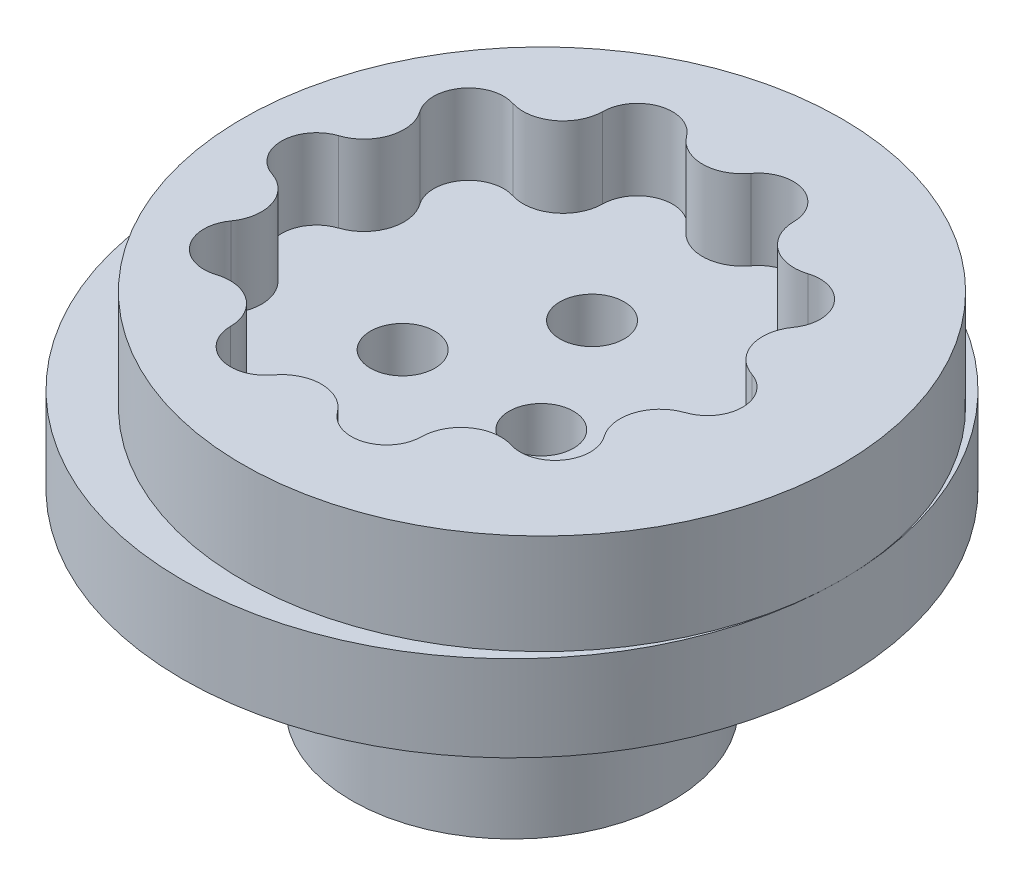
from build123d import *

# Parameters (mm, degrees)
SKETCH1_R               = 26.14295
BOSS_EXTRUDE1_DEPTH     = 8.397875
SKETCH2_R               = 12.7
BOSS_EXTRUDE2_DEPTH     = 15.08125
BOSS_EXTRUDE3_START     = 6.35
SKETCH3_R               = 26.14295
BOSS_EXTRUDE3_DEPTH     = 6.35
F_1_4_20_TAPPED_HOLE1_D = 5.1054
SKETCH6_W               = 66.50359939
SKETCH6_H               = 67.616646228
CUT_EXTRUDE2_DEPTH      = 7.9375


with BuildPart() as part:
    # Sketch1 → Boss-Extrude1 (new body)
    with BuildSketch(Plane(origin=(0, 0, 0), x_dir=(1, 0, 0), z_dir=(0, 1, 0))):
        Circle(SKETCH1_R)
    extrude(amount=-BOSS_EXTRUDE1_DEPTH)

    # Sketch2 → Boss-Extrude2 (add)
    with BuildSketch(Plane.XZ.offset(8.397875)):
        Circle(SKETCH2_R)
    extrude(amount=BOSS_EXTRUDE2_DEPTH)

    # Sketch3 → Boss-Extrude3 (add)
    with BuildSketch(Plane(origin=(0, 0, 0), x_dir=(1, 0, 0), z_dir=(0, 1, 0)).offset(BOSS_EXTRUDE3_START)):
        Circle(SKETCH3_R)
        with BuildLine():
            ThreePointArc((2.553003524, 16.40046245), (5.651302793, 17.39292157), (7.574526721, 14.768870658))
            ThreePointArc((7.574526721, 14.768870658), (7.926495509, 13.34211974), (8.883198518, 12.226673836))
            ThreePointArc((8.883198518, 12.226673836), (10.239688102, 11.661486946), (11.705373197, 11.767635017))
            ThreePointArc((11.705373197, 11.767635017), (14.795302793, 10.749416694), (14.808845207, 7.496072251))
            ThreePointArc((14.808845207, 7.496072251), (14.25497079, 6.134924448), (14.373317131, 4.670173836))
            ThreePointArc((14.373317131, 4.670173836), (15.138531738, 3.415603465), (16.386688159, 2.639970974))
            ThreePointArc((16.386688159, 2.639970974), (18.288, 0), (16.386688159, -2.639970974))
            ThreePointArc((16.386688159, -2.639970974), (15.138531738, -3.415603465), (14.373317131, -4.670173836))
            ThreePointArc((14.373317131, -4.670173836), (14.25497079, -6.134924448), (14.808845207, -7.496072251))
            ThreePointArc((14.808845207, -7.496072251), (14.795302793, -10.749416694), (11.705373197, -11.767635017))
            ThreePointArc((11.705373197, -11.767635017), (10.239688102, -11.661486946), (8.883198518, -12.226673836))
            ThreePointArc((8.883198518, -12.226673836), (7.926495509, -13.34211974), (7.574526721, -14.768870658))
            ThreePointArc((7.574526721, -14.768870658), (5.651302793, -17.39292157), (2.553003524, -16.40046245))
            ThreePointArc((2.553003524, -16.40046245), (1.429631644, -15.453078773), (0, -15.113))
            ThreePointArc((0, -15.113), (-1.429631644, -15.453078773), (-2.553003524, -16.40046245))
            ThreePointArc((-2.553003524, -16.40046245), (-5.651302793, -17.39292157), (-7.574526721, -14.768870658))
            ThreePointArc((-7.574526721, -14.768870658), (-7.926495509, -13.34211974), (-8.883198518, -12.226673836))
            ThreePointArc((-8.883198518, -12.226673836), (-10.239688102, -11.661486946), (-11.705373197, -11.767635017))
            ThreePointArc((-11.705373197, -11.767635017), (-14.795302793, -10.749416694), (-14.808845207, -7.496072251))
            ThreePointArc((-14.808845207, -7.496072251), (-14.25497079, -6.134924448), (-14.373317131, -4.670173836))
            ThreePointArc((-14.373317131, -4.670173836), (-15.138531738, -3.415603465), (-16.386688159, -2.639970974))
            ThreePointArc((-16.386688159, -2.639970974), (-18.288, 0), (-16.386688159, 2.639970974))
            ThreePointArc((-16.386688159, 2.639970974), (-15.138531738, 3.415603465), (-14.373317131, 4.670173836))
            ThreePointArc((-14.373317131, 4.670173836), (-14.25497079, 6.134924448), (-14.808845207, 7.496072251))
            ThreePointArc((-14.808845207, 7.496072251), (-14.795302793, 10.749416694), (-11.705373197, 11.767635017))
            ThreePointArc((-11.705373197, 11.767635017), (-10.239688102, 11.661486946), (-8.883198518, 12.226673836))
            ThreePointArc((-8.883198518, 12.226673836), (-7.926495509, 13.34211974), (-7.574526721, 14.768870658))
            ThreePointArc((-7.574526721, 14.768870658), (-5.651302793, 17.39292157), (-2.553003524, 16.40046245))
            ThreePointArc((-2.553003524, 16.40046245), (-1.429631644, 15.453078773), (0, 15.113))
            ThreePointArc((0, 15.113), (1.429631644, 15.453078773), (2.553003524, 16.40046245))
        make_face(mode=Mode.SUBTRACT)
    extrude(amount=-BOSS_EXTRUDE3_DEPTH)

    # 1/4-20 Tapped Hole1 (through all)
    with Locations(Plane(origin=(0, -23.479125, 0), x_dir=(-1, 0, 0), z_dir=(0, -1, 0))):
        with Locations((0, 6.35), (5.499261314, -3.175), (-5.499261314, -3.175)):
            Hole(F_1_4_20_TAPPED_HOLE1_D / 2)

    # Sketch6 → Cut-Extrude2 (cut)
    with BuildSketch(Plane(origin=(0, 6.35, 0), x_dir=(1, 0, 0), z_dir=(0, 1, 0))):
        Rectangle(SKETCH6_W, SKETCH6_H)
        with BuildLine():
            ThreePointArc((26.14295, 0), (2.38125, -23.7617), (-21.38045, 0))
            ThreePointArc((-21.38045, 0), (2.38125, 23.7617), (26.14295, 0))
        make_face(mode=Mode.SUBTRACT)
    extrude(amount=-CUT_EXTRUDE2_DEPTH, mode=Mode.SUBTRACT)


solid = part.part
